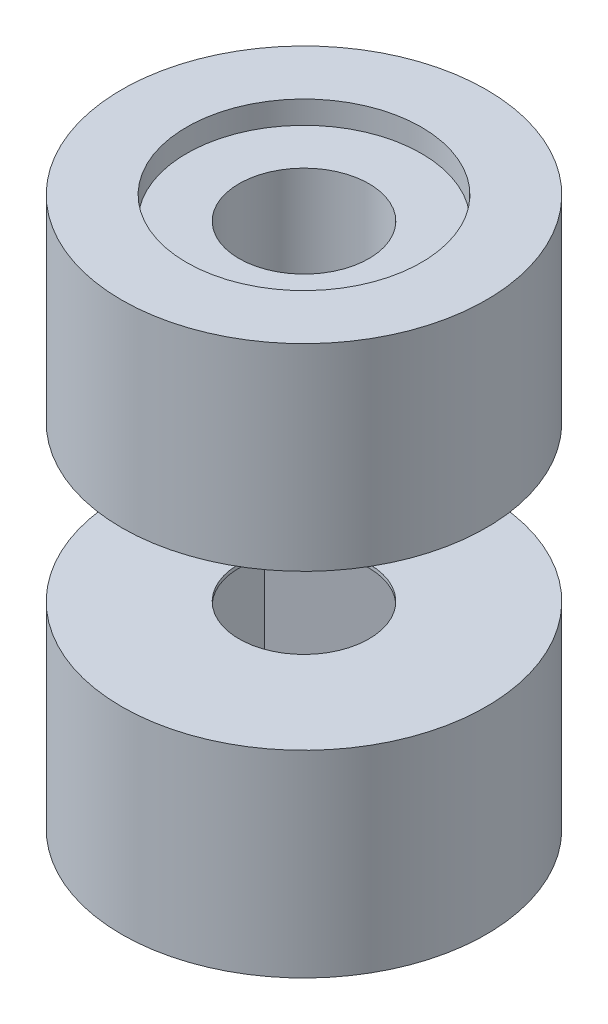
from build123d import *

# Parameters (mm, degrees)
SKETCH1_R               = 8
BOSS_EXTRUDE1_DEPTH     = 24.11
CUT_EXTRUDE1_DEPTH      = 27.632538369
CUT_EXTRUDE1_DEPTH_BACK = 27.632538369
SKETCH2_W               = 20.4
SKETCH2_H               = 6.8
SKETCH3_R               = 2.85
CUT_EXTRUDE2_DEPTH      = 24.11
SKETCH4_R               = 5.15
CUT_EXTRUDE3_DEPTH      = 1
CUT_EXTRUDE4_DEPTH      = 8.5


with BuildPart() as part:
    # Sketch1 → Boss-Extrude1 (new body)
    with BuildSketch(Plane(origin=(0, 0, 0), x_dir=(1, 0, 0), z_dir=(0, 1, 0))):
        Circle(SKETCH1_R)
    extrude(amount=BOSS_EXTRUDE1_DEPTH)

    # Sketch2 → Cut-Extrude1 (cut, two sides: drawn at the far end of the back side and taken through both)
    with BuildSketch(Plane.XY.offset(-CUT_EXTRUDE1_DEPTH_BACK)):
        with Locations((0, 12.055)):
            Rectangle(SKETCH2_W, SKETCH2_H)
    extrude(amount=CUT_EXTRUDE1_DEPTH + CUT_EXTRUDE1_DEPTH_BACK, mode=Mode.SUBTRACT)


with BuildPart() as cut_extrude1_piece_1:
    # of the separate pieces the step leaves, piece 1, a body of its own (cut_extrude1_pieces)
    add(part.part.solids().sort_by_distance((8, 0, 0))[0])


with BuildPart() as cut_extrude1_piece_2:
    # of the separate pieces the step leaves, piece 2, a body of its own (cut_extrude1_pieces)
    add(part.part.solids().sort_by_distance((8, 15.455, 0))[0])


with BuildPart() as cut_extrude2_tool:
    # Sketch3 → Cut-Extrude2 (new body)
    with BuildSketch(Plane(origin=(0, 0, 0), x_dir=(1, 0, 0), z_dir=(0, 1, 0))):
        Circle(SKETCH3_R)
    extrude(amount=CUT_EXTRUDE2_DEPTH)


with BuildPart() as cut_extrude1_piece_1_1:
    add(cut_extrude1_piece_1.part)

    # Cut-Extrude2: cut by cut_extrude2_tool
    add(cut_extrude2_tool.part, mode=Mode.SUBTRACT)

    # Sketch5 → Cut-Extrude4 (cut)
    with BuildSketch(Plane(origin=(0, 0, 0), x_dir=(1, 0, 0), z_dir=(0, 1, 0))):
        Polygon((4.1, -2.367136104), (0, -4.734272207), (-4.1, -2.367136104), (-4.1, 2.367136104), (0, 4.734272207), (4.1, 2.367136104), align=None)
    extrude(amount=CUT_EXTRUDE4_DEPTH, mode=Mode.SUBTRACT)


with BuildPart() as cut_extrude1_piece_2_1:
    add(cut_extrude1_piece_2.part)

    # Cut-Extrude2: cut by cut_extrude2_tool
    add(cut_extrude2_tool.part, mode=Mode.SUBTRACT)

    # Sketch4 → Cut-Extrude3 (cut)
    with BuildSketch(Plane(origin=(0, 24.11, 0), x_dir=(1, 0, 0), z_dir=(0, 1, 0))):
        Circle(SKETCH4_R)
    extrude(amount=-CUT_EXTRUDE3_DEPTH, mode=Mode.SUBTRACT)


solid = Compound([cut_extrude1_piece_1_1.part, cut_extrude1_piece_2_1.part])
